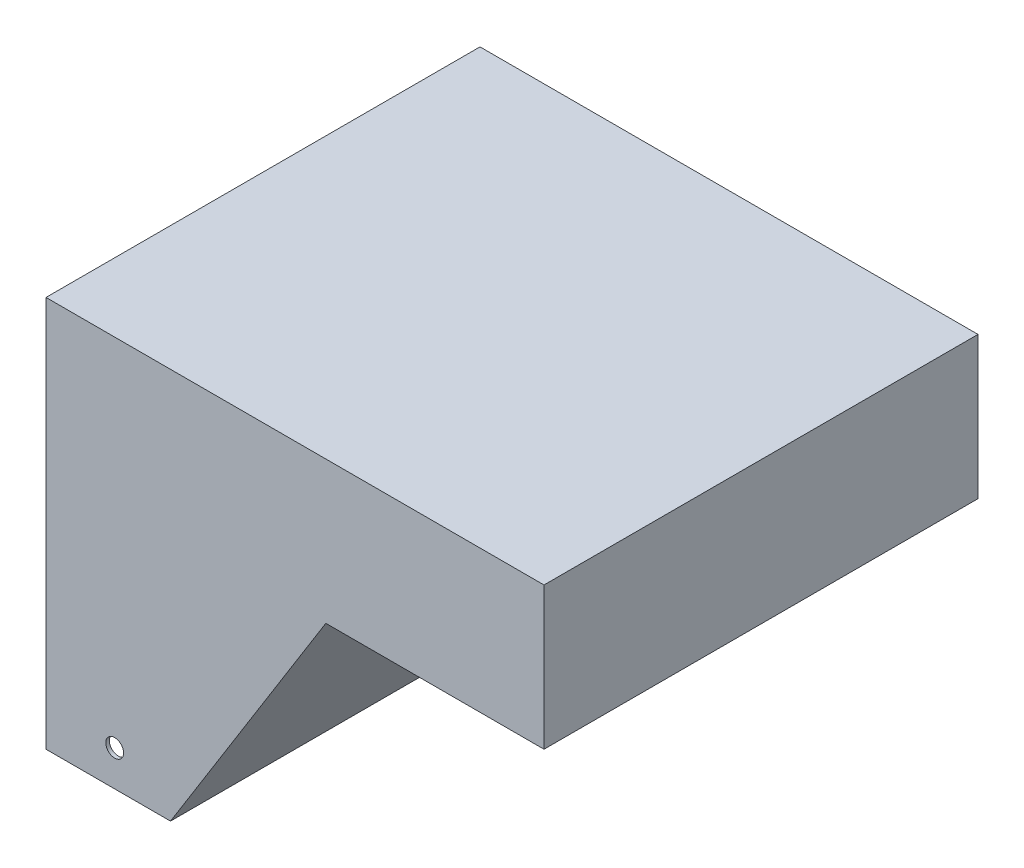
from build123d import *

# Parameters (mm, degrees)
SKETCH2_R           = 6.35
BOSS_EXTRUDE1_DEPTH = 2.54
BOSS_EXTRUDE2_DEPTH = 304.8
CUT_EXTRUDE1_REACH  = 550.217
SKETCH4_R           = 1.5875


with BuildPart() as part:
    # Sketch2 → Boss-Extrude1 (new body)
    with BuildSketch(Plane.XY):
        Polygon((0, 0), (355.6, 0), (355.6, -101.6), (199.80781759, -101.6), (88.9, -279.4), (0, -279.4), align=None)
        with Locations((49.038050814, -254)):
            Circle(SKETCH2_R, mode=Mode.SUBTRACT)
    boss_extrude1 = extrude(amount=BOSS_EXTRUDE1_DEPTH)

    # Sketch3 → Boss-Extrude2 (add)
    with BuildSketch(Plane.XY.offset(2.54)):
        Polygon((2.54, -279.4), (2.54, -276.86), (2.54, -2.54), (353.06, -2.54), (353.06, -99.06), (198.398569196, -99.06), (87.490751606, -276.86), (87.490751606, -279.4), (88.9, -279.4), (199.80781759, -101.6), (355.6, -101.6), (355.6, 0), (0, 0), (0, -279.4), align=None)
    extrude(amount=BOSS_EXTRUDE2_DEPTH)

    # Mirror1: Boss-Extrude1 across plane
    add(boss_extrude1.mirror(Plane.XY.offset(154.94)))

    # Sketch4 → Cut-Extrude1 (cut, up to next)
    with BuildSketch(Plane.ZY, mode=Mode.PRIVATE) as cut_extrude1_sk1:
        with Locations((120.015, -244.851012913)):
            Circle(SKETCH4_R)
    cut_extrude1_tool1 = extrude(cut_extrude1_sk1.sketch, amount=-CUT_EXTRUDE1_REACH, mode=Mode.PRIVATE) & part.part
    # Sketch4 → Cut-Extrude1 (cut, up to next)
    with BuildSketch(Plane.ZY, mode=Mode.PRIVATE) as cut_extrude1_sk2:
        with Locations((120.015, -270.251012913)):
            Circle(SKETCH4_R)
    cut_extrude1_tool2 = extrude(cut_extrude1_sk2.sketch, amount=-CUT_EXTRUDE1_REACH, mode=Mode.PRIVATE) & part.part
    # Sketch4 → Cut-Extrude1 (cut, up to next)
    with BuildSketch(Plane.ZY, mode=Mode.PRIVATE) as cut_extrude1_sk3:
        with Locations((189.865, -244.851012913)):
            Circle(SKETCH4_R)
    cut_extrude1_tool3 = extrude(cut_extrude1_sk3.sketch, amount=-CUT_EXTRUDE1_REACH, mode=Mode.PRIVATE) & part.part
    # Sketch4 → Cut-Extrude1 (cut, up to next)
    with BuildSketch(Plane.ZY, mode=Mode.PRIVATE) as cut_extrude1_sk4:
        with Locations((189.865, -270.251012913)):
            Circle(SKETCH4_R)
    cut_extrude1_tool4 = extrude(cut_extrude1_sk4.sketch, amount=-CUT_EXTRUDE1_REACH, mode=Mode.PRIVATE) & part.part
    add(cut_extrude1_tool1.solids().sort_by_distance((0, -244.851013, 120.015))[0], mode=Mode.SUBTRACT)
    add(cut_extrude1_tool2.solids().sort_by_distance((0, -270.251013, 120.015))[0], mode=Mode.SUBTRACT)
    add(cut_extrude1_tool3.solids().sort_by_distance((0, -244.851013, 189.865))[0], mode=Mode.SUBTRACT)
    add(cut_extrude1_tool4.solids().sort_by_distance((0, -270.251013, 189.865))[0], mode=Mode.SUBTRACT)


solid = part.part
